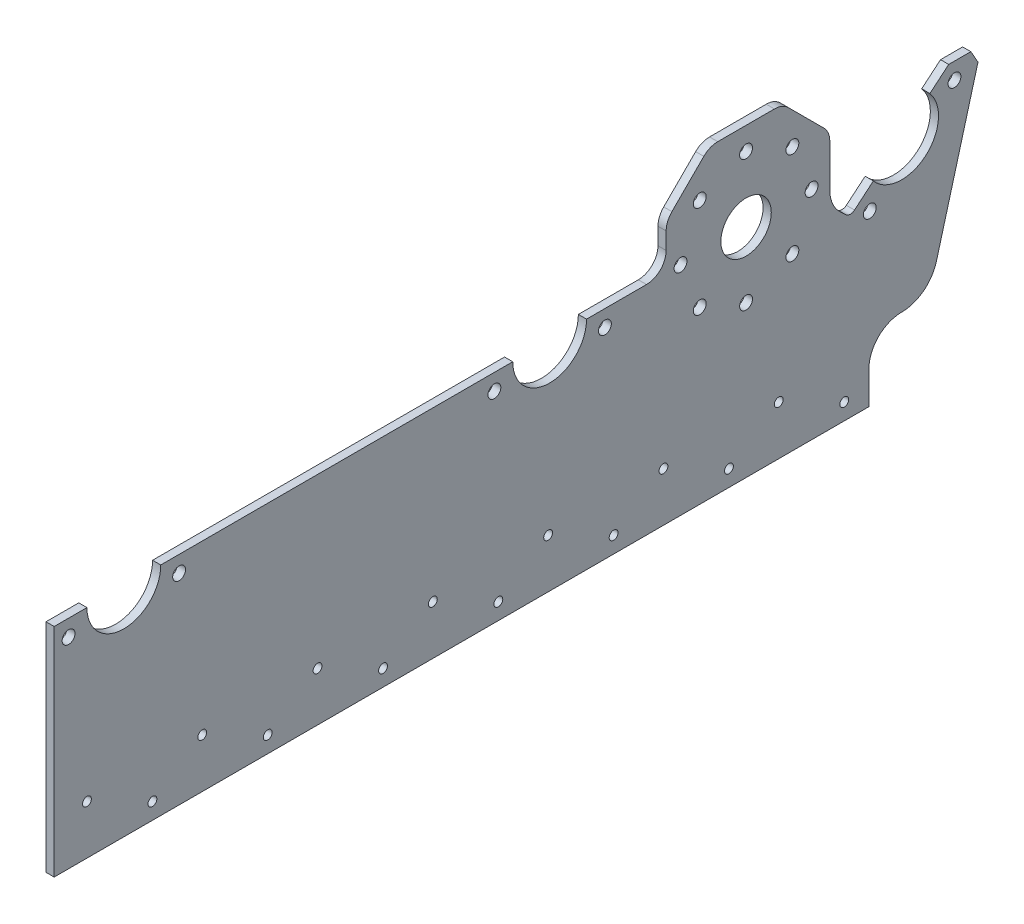
from build123d import *

# Parameters (mm, degrees)
SKETCH1_R                        = 9.779
SKETCH1_R_2                      = 2.413
BOSS_EXTRUDE1_DEPTH              = 3.175
F_10_CLEARANCE_HOLE1_D           = 4.9784
F_10_CLEARANCE_HOLE2_D           = 4.9784
F_10_CLEARANCE_HOLE2_DEPTH       = 3.175
F_10_CLEARANCE_HOLE2_TIP         = 1.495662253
CHAMFER1_SIZE                    = 5.08
CHAMFER1_SIZE2                   = 4.1342197
FILLET1_R                        = 7.62
F_1_8_0_135_DIAMETER_HOLE1_D     = 3.429
F_1_8_0_135_DIAMETER_HOLE1_DEPTH = 16.51
F_1_8_0_135_DIAMETER_HOLE1_TIP   = 1.030175531


with BuildPart() as part:
    # Sketch1 → Boss-Extrude1 (new body)
    with BuildSketch(Plane(origin=(0, 0, 0), x_dir=(0, 0, -1), z_dir=(1, 0, 0))):
        with BuildLine():
            Line((-12.7, -12.7), (-328.6379, -12.7))
            Line((-328.6379, -12.7), (-328.6379, 71.4629))
            Line((-328.6379, 71.4629), (-315.9379, 71.4629))
            ThreePointArc((-315.9379, 71.4629), (-301.625, 57.15), (-287.3121, 71.4629))
            Line((-287.3121, 71.4629), (-150.8125, 71.4629))
            ThreePointArc((-150.8125, 71.4629), (-136.4996, 57.15), (-122.1867, 71.4629))
            Line((-122.1867, 71.4629), (-91.313, 71.4629))
            Line((-91.313, 71.4629), (-91.313, 88.788677931))
            Line((-91.313, 88.788677931), (-74.475777931, 105.6259))
            Line((-74.475777931, 105.6259), (-46.174222069, 105.6259))
            Line((-46.174222069, 105.6259), (-27.855333333, 87.307011265))
            Line((-27.855333333, 87.307011265), (-27.855333333, 67.615437998))
            ThreePointArc((-27.855333333, 67.615437998), (-26.836905275, 62.632379001), (-23.944959008, 58.448514823))
            Line((-23.944959008, 58.448514823), (-21.653228214, 56.251108404))
            ThreePointArc((-21.653228214, 56.251108404), (-19.979435171, 55.545886769), (-18.262622551, 56.138740153))
            Line((-18.262622551, 56.138740153), (-10.96431751, 62.262745221))
            ThreePointArc((-10.96431751, 62.262745221), (9.200154779, 60.49858249), (10.96431751, 80.663054779))
            Line((10.96431751, 80.663054779), (18.262622551, 86.787059847))
            Line((18.262622551, 86.787059847), (30.962622551, 86.787059847))
            Line((30.962622551, 86.787059847), (13.473085073, 22.977185543))
            ThreePointArc((13.473085073, 22.977185543), (8.472670241, 15.562580904), (0, 12.7))
            ThreePointArc((0, 12.7), (-8.980256121, 8.980256121), (-12.7, 0))
            Line((-12.7, 0), (-12.7, -12.7))
        make_face()
        with Locations((-60.325, 71.4629)):
            Circle(SKETCH1_R, mode=Mode.SUBTRACT)
        with Locations((-60.325, 96.8629)):
            Circle(SKETCH1_R_2, mode=Mode.SUBTRACT)
        with Locations((-42.364487758, 89.423412242)):
            Circle(SKETCH1_R_2, mode=Mode.SUBTRACT)
        with Locations((-34.925, 71.4629)):
            Circle(SKETCH1_R_2, mode=Mode.SUBTRACT)
        with Locations((-42.364487758, 53.502387758)):
            Circle(SKETCH1_R_2, mode=Mode.SUBTRACT)
        with Locations((-60.325, 46.0629)):
            Circle(SKETCH1_R_2, mode=Mode.SUBTRACT)
        with Locations((-78.285512242, 53.502387758)):
            Circle(SKETCH1_R_2, mode=Mode.SUBTRACT)
        with Locations((-85.725, 71.4629)):
            Circle(SKETCH1_R_2, mode=Mode.SUBTRACT)
        with Locations((-78.285512242, 89.423412242)):
            Circle(SKETCH1_R_2, mode=Mode.SUBTRACT)
    extrude(amount=BOSS_EXTRUDE1_DEPTH)

    # #10 Clearance Hole1 (through all)
    with Locations(Plane(origin=(3.175, 0, 0), x_dir=(0, 0, -1), z_dir=(1, 0, 0))):
        with Locations((-323.05625, 65.1129), (-280.19375, 65.1129), (-157.93085, 65.1129), (-115.06835, 65.1129), (-12.33558865, 52.822775826), (20.498991293, 80.374259746)):
            Hole(F_10_CLEARANCE_HOLE1_D / 2)

    # #10 Clearance Hole2
    with Locations(Plane(origin=(3.175, 0, 0), x_dir=(0, 0, -1), z_dir=(1, 0, 0))):
        with Locations((-60.325, 96.8629), (-42.364487758, 89.423412242), (-34.925, 71.4629), (-42.364487758, 53.502387758), (-60.325, 46.0629), (-78.285512242, 53.502387758), (-85.725, 71.4629), (-78.285512242, 89.423412242)):
            Hole(F_10_CLEARANCE_HOLE2_D / 2, depth=F_10_CLEARANCE_HOLE2_DEPTH)
            with Locations((0, 0, -(F_10_CLEARANCE_HOLE2_DEPTH + F_10_CLEARANCE_HOLE2_TIP / 2))):  # 118° drill point
                Cone(0, F_10_CLEARANCE_HOLE2_D / 2, F_10_CLEARANCE_HOLE2_TIP, mode=Mode.SUBTRACT)

    # Chamfer1
    chamfer1_edges = [part.edges().sort_by_distance(p)[0] for p in [
        (1.5875, 86.787059847, -30.962622551),
    ]]
    chamfer1_side = [part.faces().sort_by_distance(p)[0] for p in [
        (1.5875, 54.882122695, -22.217853812),
    ]]
    chamfer(chamfer1_edges, length=CHAMFER1_SIZE, length2=CHAMFER1_SIZE2, reference=chamfer1_side[0])

    # Fillet1
    fillet1_edges = [part.edges().sort_by_distance(p)[0] for p in [
        (1.5875, 87.307011265, 27.855333333),
        (1.5875, 105.6259, 46.174222069),
        (1.5875, 105.6259, 74.475777931),
        (1.5875, 88.788677931, 91.313),
        (1.5875, 71.4629, 91.313),
    ]]
    fillet(fillet1_edges, radius=FILLET1_R)

    # 1/8 (0.135) Diameter Hole1
    with Locations(Plane.ZY):
        with Locations((22.2504, -6.35), (47.6504, 6.35), (66.964983333, -6.35), (92.364983333, 6.35), (111.679566667, -6.35), (137.079566667, 6.35), (156.39415, -6.35), (181.79415, 6.35), (201.108733333, -6.35), (226.508733333, 6.35), (245.823316667, -6.35), (271.223316667, 6.35), (290.5379, -6.35), (315.9379, 6.35)):
            Hole(F_1_8_0_135_DIAMETER_HOLE1_D / 2, depth=F_1_8_0_135_DIAMETER_HOLE1_DEPTH)
            with Locations((0, 0, -(F_1_8_0_135_DIAMETER_HOLE1_DEPTH + F_1_8_0_135_DIAMETER_HOLE1_TIP / 2))):  # 118° drill point
                Cone(0, F_1_8_0_135_DIAMETER_HOLE1_D / 2, F_1_8_0_135_DIAMETER_HOLE1_TIP, mode=Mode.SUBTRACT)


solid = part.part
